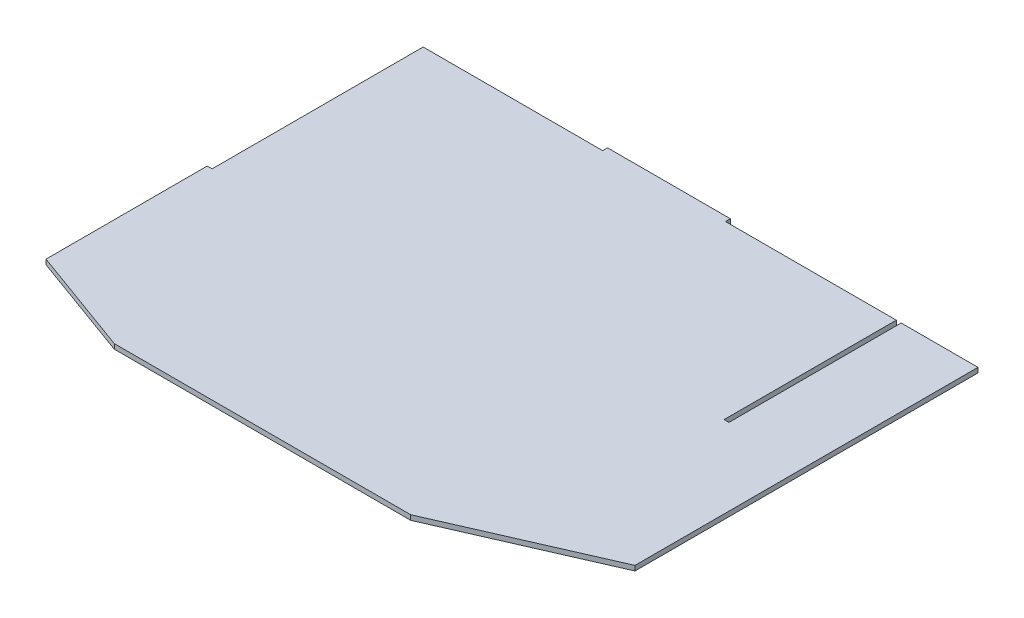
from build123d import *

# Parameters (mm, degrees)
SKETCH1_W           = 311.277
SKETCH1_H           = 3.175
BOSS_EXTRUDE1_DEPTH = 267.83
SKETCH3_W           = 155.702
SKETCH3_H           = 3.175
BOSS_EXTRUDE3_DEPTH = 3.175
SKETCH4_W           = 50.038
SKETCH4_H           = 3.175
BOSS_EXTRUDE4_DEPTH = 267.83
CUT_EXTRUDE1_DEPTH  = 340.649729247
SKETCH8_W           = 80
SKETCH8_H           = 3.175
BOSS_EXTRUDE6_DEPTH = 3.175
SKETCH10_W          = 3.175
SKETCH10_H          = 137.414
CUT_EXTRUDE2_DEPTH  = 340.649729247
CUT_EXTRUDE3_DEPTH  = 340.649729247


with BuildPart() as part:
    # Sketch1 → Boss-Extrude1 (new body)
    with BuildSketch(Plane.XY):
        Rectangle(SKETCH1_W, SKETCH1_H)
    extrude(amount=BOSS_EXTRUDE1_DEPTH)

    # Sketch3 → Boss-Extrude3 (add)
    with BuildSketch(Plane(origin=(155.6385, 0, 0), x_dir=(0, 0, -1), z_dir=(1, 0, 0))):
        with Locations((-189.979, 0)):
            Rectangle(SKETCH3_W, SKETCH3_H)
    extrude(amount=BOSS_EXTRUDE3_DEPTH)

    # Sketch4 → Boss-Extrude4 (add)
    with BuildSketch(Plane.XY.offset(267.83)):
        with Locations((183.8325, 0)):
            Rectangle(SKETCH4_W, SKETCH4_H)
    extrude(amount=-BOSS_EXTRUDE4_DEPTH)

    # Sketch6 → Cut-Extrude1 (cut, through all)
    with BuildSketch(Plane(origin=(0, 1.5875, 0), x_dir=(1, 0, 0), z_dir=(0, 1, 0))):
        Polygon((208.8515, -223.38), (107.2515, -267.83), (208.8515, -267.83), align=None)
    extrude(amount=-CUT_EXTRUDE1_DEPTH, mode=Mode.SUBTRACT)

    # Sketch8 → Boss-Extrude6 (add)
    with BuildSketch(Plane(origin=(0, 0, 0), x_dir=(-1, 0, 0), z_dir=(0, 0, -1))):
        with Locations((-4.41849998, 0)):
            Rectangle(SKETCH8_W, SKETCH8_H)
    extrude(amount=BOSS_EXTRUDE6_DEPTH)

    # Sketch10 → Cut-Extrude2 (cut, through all)
    with BuildSketch(Plane.XZ.offset(1.5875)):
        with Locations((-154.051, 68.707)):
            Rectangle(SKETCH10_W, SKETCH10_H)
    extrude(amount=-CUT_EXTRUDE2_DEPTH, mode=Mode.SUBTRACT)

    # Sketch11 → Cut-Extrude3 (cut, through all)
    with BuildSketch(Plane.XZ.offset(1.5875)):
        Polygon((-155.6385, 242.43), (-85.7885, 267.83), (-155.6385, 267.83), align=None)
    extrude(amount=-CUT_EXTRUDE3_DEPTH, mode=Mode.SUBTRACT)


solid = part.part
